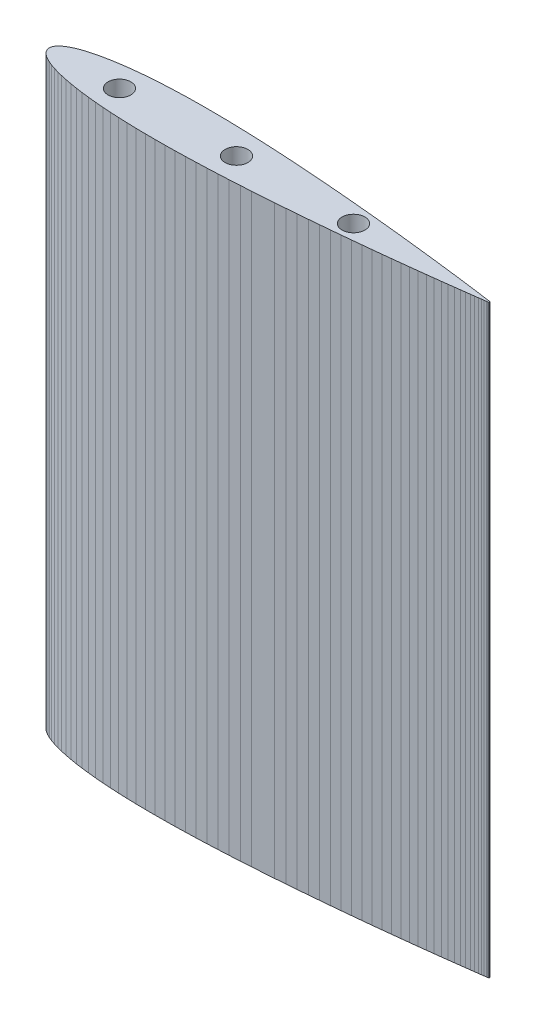
from build123d import *

# Parameters (mm, degrees)
BOSS_EXTRUDE1_DEPTH = 50
SKETCH2_R           = 1.95
CUT_EXTRUDE1_DEPTH  = 15


with BuildPart() as part:
    # Sketch1 → Boss-Extrude1 (new, symmetric)
    with BuildSketch(Plane(origin=(0, 0, 0), x_dir=(1, 0, 0), z_dir=(0, 1, 0))):
        Polygon((75.235109718, 0.091180625), (75.189968652, 0.097805643), (75.062068966, 0.120376176), (74.843887147, 0.150470219), (74.535423197, 0.195611285), (74.144200627, 0.248275862), (73.662695925, 0.315987461), (73.105956113, 0.391222571), (72.458934169, 0.473981191), (71.729153605, 0.571786834), (70.924137931, 0.677115987), (70.043887147, 0.789968652), (69.080877743, 0.917868339), (68.05015674, 1.045768025), (66.944200627, 1.181191223), (65.778056426, 1.324137931), (64.536677116, 1.47460815), (63.235109718, 1.62507837), (61.873354232, 1.7830721), (60.458934169, 1.941065831), (58.984326019, 2.106583072), (57.464576803, 2.272100313), (55.89968652, 2.430094044), (54.289655172, 2.595611285), (52.64200627, 2.761128527), (50.956739812, 2.919122257), (49.24137931, 3.077115987), (47.503448276, 3.235109718), (45.735423197, 3.385579937), (43.952351097, 3.528526646), (42.154231975, 3.671473354), (40.341065831, 3.799373041), (38.527899687, 3.927272727), (36.707210031, 4.040125392), (34.894043887, 4.145454545), (33.080877743, 4.235736677), (31.282758621, 4.318495298), (29.49968652, 4.386206897), (27.731661442, 4.438871473), (25.993730408, 4.484012539), (24.278369906, 4.506583072), (22.593103448, 4.514106583), (20.945454545, 4.506583072), (19.335423197, 4.484012539), (17.770532915, 4.438871473), (16.250783699, 4.378683386), (14.776175549, 4.303448276), (13.361755486, 4.205642633), (12, 4.092789969), (10.698432602, 3.957366771), (9.457053292, 3.814420063), (8.290909091, 3.648902821), (7.184952978, 3.460815047), (6.154231975, 3.265203762), (5.191222571, 3.054545455), (4.310971787, 2.828840125), (3.505956113, 2.595611285), (2.776175549, 2.347335423), (2.129153605, 2.084012539), (1.572413793, 1.813166144), (1.090909091, 1.527272727), (0.69968652, 1.24137931), (0.391222571, 0.940438871), (0.173040752, 0.631974922), (0.045141066, 0.323510972), (0, 0), (0.045141066, -0.323510972), (0.173040752, -0.631974922), (0.391222571, -0.940438871), (0.69968652, -1.24137931), (1.090909091, -1.527272727), (1.572413793, -1.813166144), (2.129153605, -2.084012539), (2.776175549, -2.347335423), (3.505956113, -2.595611285), (4.310971787, -2.828840125), (5.191222571, -3.054545455), (6.154231975, -3.265203762), (7.184952978, -3.460815047), (8.290909091, -3.648902821), (9.457053292, -3.814420063), (10.698432602, -3.957366771), (12, -4.092789969), (13.361755486, -4.205642633), (14.776175549, -4.303448276), (16.250783699, -4.378683386), (17.770532915, -4.438871473), (19.335423197, -4.484012539), (20.945454545, -4.506583072), (22.593103448, -4.514106583), (24.278369906, -4.506583072), (25.993730408, -4.484012539), (27.731661442, -4.438871473), (29.49968652, -4.386206897), (31.282758621, -4.318495298), (33.080877743, -4.235736677), (34.894043887, -4.145454545), (36.707210031, -4.040125392), (38.527899687, -3.927272727), (40.341065831, -3.799373041), (42.154231975, -3.671473354), (43.952351097, -3.528526646), (45.735423197, -3.385579937), (47.503448276, -3.235109718), (49.24137931, -3.077115987), (50.956739812, -2.919122257), (52.64200627, -2.761128527), (54.289655172, -2.595611285), (55.89968652, -2.430094044), (57.464576803, -2.272100313), (58.984326019, -2.106583072), (60.458934169, -1.941065831), (61.873354232, -1.7830721), (63.235109718, -1.62507837), (64.536677116, -1.47460815), (65.778056426, -1.324137931), (66.944200627, -1.181191223), (68.05015674, -1.045768025), (69.080877743, -0.917868339), (70.043887147, -0.789968652), (70.924137931, -0.677115987), (71.729153605, -0.571786834), (72.458934169, -0.473981191), (73.105956113, -0.391222571), (73.662695925, -0.315987461), (74.144200627, -0.248275862), (74.535423197, -0.195611285), (74.843887147, -0.150470219), (75.062068966, -0.120376176), (75.189968652, -0.097805643), (75.235109718, -0.088690057), align=None)
    extrude(amount=BOSS_EXTRUDE1_DEPTH, both=True)

    # Sketch2 → Cut-Extrude1 (cut)
    with BuildSketch(Plane(origin=(0, 50, 0), x_dir=(1, 0, 0), z_dir=(0, 1, 0))):
        with Locations((11.999999998, 0.000198623)):
            Circle(SKETCH2_R)
        with Locations((31.999999996, 0.000529661)):
            Circle(SKETCH2_R)
        with Locations((51.999999993, 0.000860699)):
            Circle(SKETCH2_R)
    cut_extrude1 = extrude(amount=-CUT_EXTRUDE1_DEPTH, mode=Mode.SUBTRACT)

    # Mirror1: Cut-Extrude1 across plane
    add(cut_extrude1.mirror(Plane.ZX), mode=Mode.SUBTRACT)


solid = part.part
